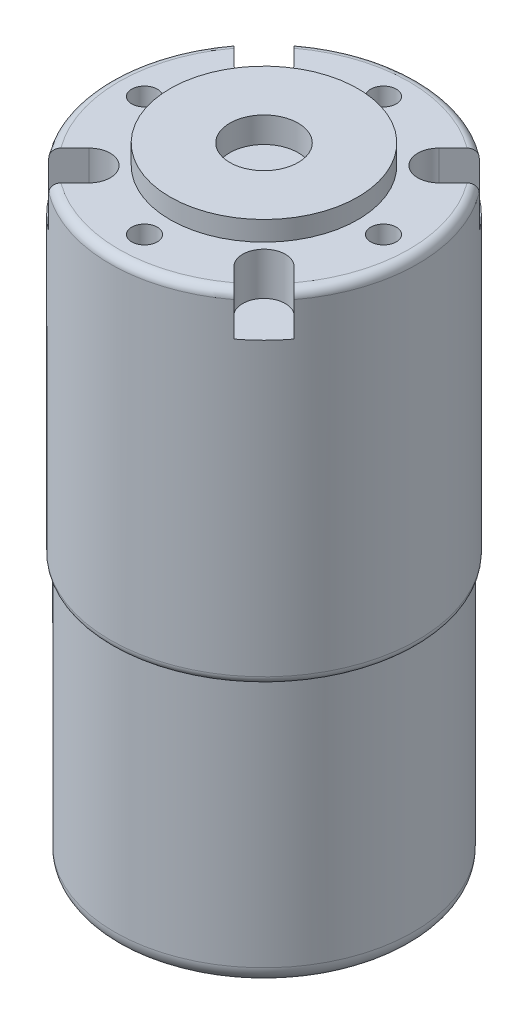
from build123d import *

# Parameters (mm, degrees)
SKETCH1_R           = 17.5
BOSS_EXTRUDE1_DEPTH = 31
SKETCH2_R           = 18
BOSS_EXTRUDE2_DEPTH = 40
FILLET1_R           = 2
FILLET2_R           = 1
SKETCH3_R           = 11
BOSS_EXTRUDE3_DEPTH = 2.3
SKETCH4_R           = 4
CUT_EXTRUDE1_DEPTH  = 3
SKETCH5_R           = 1.5
CUT_EXTRUDE2_DEPTH  = 5
FILLET3_R           = 1
CUT_EXTRUDE3_START  = -5
CUT_EXTRUDE3_DEPTH  = 5


with BuildPart() as part:
    # Sketch1 → Boss-Extrude1 (new body)
    with BuildSketch(Plane(origin=(0, 0, 0), x_dir=(1, 0, 0), z_dir=(0, 1, 0))):
        with Locations(Location((0, 0, 0), (0, 0, 270))):
            Circle(SKETCH1_R)
    extrude(amount=BOSS_EXTRUDE1_DEPTH)

    # Sketch2 → Boss-Extrude2 (add)
    with BuildSketch(Plane(origin=(0, 31, 0), x_dir=(1, 0, 0), z_dir=(0, 1, 0))):
        with Locations(Location((0, 0, 0), (0, 0, 270))):
            Circle(SKETCH2_R)
    extrude(amount=BOSS_EXTRUDE2_DEPTH)

    # Fillet1
    fillet1_edges = [part.edges().sort_by_distance(p)[0] for p in [
        (0, 0, -17.5),
    ]]
    fillet(fillet1_edges, radius=FILLET1_R)

    # Fillet2
    # the kernel refuses this fillet: 1 mm, written as the material it takes off along each edge
    with BuildSketch(Plane(origin=(0, 31, 0), x_dir=(0, 0, 1), z_dir=(-1, 0, 0))) as fillet2_piece_1:
        with BuildLine():
            CenterArc((17, 0.866025404), FILLET2_R, 300, 60)
            Line((18, 0.866025404), (18.02, 0.866025404))
            Line((18.02, 0.866025404), (18.02, 0))
            Line((18.02, 0), (18, -0.02))
            ThreePointArc((18, -0.02), (17.75, -0.02), (17.51, -0.017320508))
            Line((17.51, -0.017320508), (17.5, 0))
        make_face()
    revolve(axis=Axis((0, 31, 0), (0, 1, 0)), mode=Mode.SUBTRACT)

    # Sketch3 → Boss-Extrude3 (add)
    with BuildSketch(Plane(origin=(0, 71, 0), x_dir=(1, 0, 0), z_dir=(0, 1, 0))):
        with Locations(Location((0, 0, 0), (0, 0, 270))):
            Circle(SKETCH3_R)
    extrude(amount=BOSS_EXTRUDE3_DEPTH)

    # Sketch4 → Cut-Extrude1 (cut)
    with BuildSketch(Plane(origin=(0, 73.3, 0), x_dir=(1, 0, 0), z_dir=(0, 1, 0))):
        with Locations(Location((0, 0, 0), (0, 0, 270))):
            Circle(SKETCH4_R)
    extrude(amount=-CUT_EXTRUDE1_DEPTH, mode=Mode.SUBTRACT)

    # Sketch5 → Cut-Extrude2 (cut)
    with BuildSketch(Plane(origin=(0, 71, 0), x_dir=(1, 0, 0), z_dir=(0, 1, 0))):
        with Locations(Location((-14, 0, 0), (0, 0, 270))):
            Circle(SKETCH5_R)
        with Locations(Location((0, 14, 0), (0, 0, 270))):
            Circle(SKETCH5_R)
        with Locations(Location((14, 0, 0), (0, 0, 270))):
            Circle(SKETCH5_R)
        with Locations(Location((0, -14, 0), (0, 0, 270))):
            Circle(SKETCH5_R)
    extrude(amount=-CUT_EXTRUDE2_DEPTH, mode=Mode.SUBTRACT)

    # Fillet3
    fillet3_edges = [part.edges().sort_by_distance(p)[0] for p in [
        (0, 71, -18),
    ]]
    fillet(fillet3_edges, radius=FILLET3_R)

    # Sketch6 → Cut-Extrude3 (cut)
    with BuildSketch(Plane(origin=(0, 71, 0), x_dir=(1, 0, 0), z_dir=(0, 1, 0)).offset(CUT_EXTRUDE3_START)):
        with BuildLine():
            Line((-14.372329619, 10.836795713), (-12.02081528, 8.485281374))
            ThreePointArc((-12.02081528, 8.485281374), (-8.485281374, 8.485281374), (-8.485281374, 12.02081528))
            Line((-8.485281374, 12.02081528), (-10.836795713, 14.372329619))
            ThreePointArc((-10.836795713, 14.372329619), (-12.727922061, 12.727922061), (-14.372329619, 10.836795713))
        make_face()
        with BuildLine():
            Line((14.372329619, 10.836795713), (12.02081528, 8.485281374))
            ThreePointArc((12.02081528, 8.485281374), (8.485281374, 8.485281374), (8.485281374, 12.02081528))
            Line((8.485281374, 12.02081528), (10.836795713, 14.372329619))
            ThreePointArc((10.836795713, 14.372329619), (12.727922061, 12.727922061), (14.372329619, 10.836795713))
        make_face()
        with BuildLine():
            Line((10.836795713, -14.372329619), (8.485281374, -12.02081528))
            ThreePointArc((8.485281374, -12.02081528), (8.485281374, -8.485281374), (12.02081528, -8.485281374))
            Line((12.02081528, -8.485281374), (14.372329619, -10.836795713))
            ThreePointArc((14.372329619, -10.836795713), (12.727922061, -12.727922061), (10.836795713, -14.372329619))
        make_face()
        with BuildLine():
            Line((-14.372329619, -10.836795713), (-12.02081528, -8.485281374))
            ThreePointArc((-12.02081528, -8.485281374), (-8.485281374, -8.485281374), (-8.485281374, -12.02081528))
            Line((-8.485281374, -12.02081528), (-10.836795713, -14.372329619))
            ThreePointArc((-10.836795713, -14.372329619), (-12.727922061, -12.727922061), (-14.372329619, -10.836795713))
        make_face()
    extrude(amount=CUT_EXTRUDE3_DEPTH, mode=Mode.SUBTRACT)


solid = part.part
